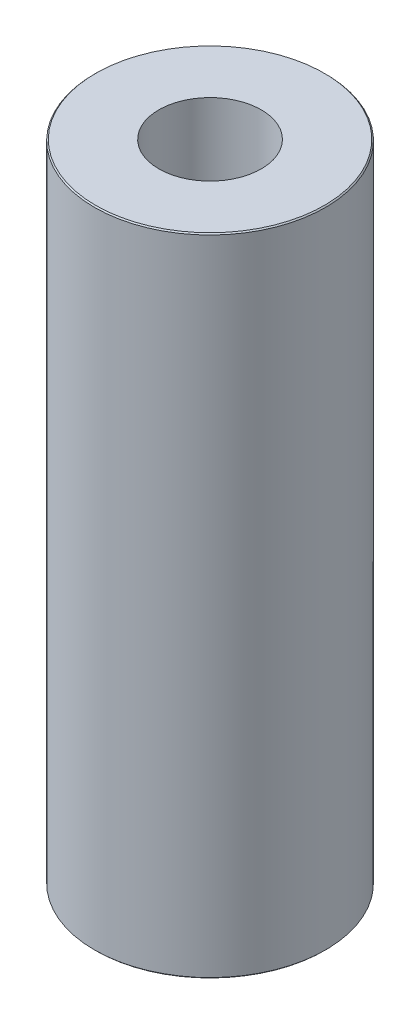
from build123d import *

# Parameters (mm, degrees)
SKETCH1_R           = 47.5
BOSS_EXTRUDE1_DEPTH = 265.290275823
SKETCH2_R           = 21.049773297
CUT_EXTRUDE1_DEPTH  = 274.662986986
CHAMFER1_SIZE       = 0.478187054


with BuildPart() as part:
    # Sketch1 → Boss-Extrude1 (new body)
    with BuildSketch(Plane(origin=(0, 0, 0), x_dir=(1, 0, 0), z_dir=(0, 1, 0))):
        Circle(SKETCH1_R)
    extrude(amount=BOSS_EXTRUDE1_DEPTH)

    # Sketch2 → Cut-Extrude1 (cut, through all)
    with BuildSketch(Plane(origin=(0, 0, 0), x_dir=(1, 0, 0), z_dir=(0, 1, 0))):
        Circle(SKETCH2_R)
    extrude(amount=CUT_EXTRUDE1_DEPTH, mode=Mode.SUBTRACT)

    # Chamfer1
    chamfer1_edges = [part.edges().sort_by_distance(p)[0] for p in [
        (-47.5, 265.290275823, 0),
        (-47.5, 0, 0),
    ]]
    chamfer(chamfer1_edges, length=CHAMFER1_SIZE)


solid = part.part
